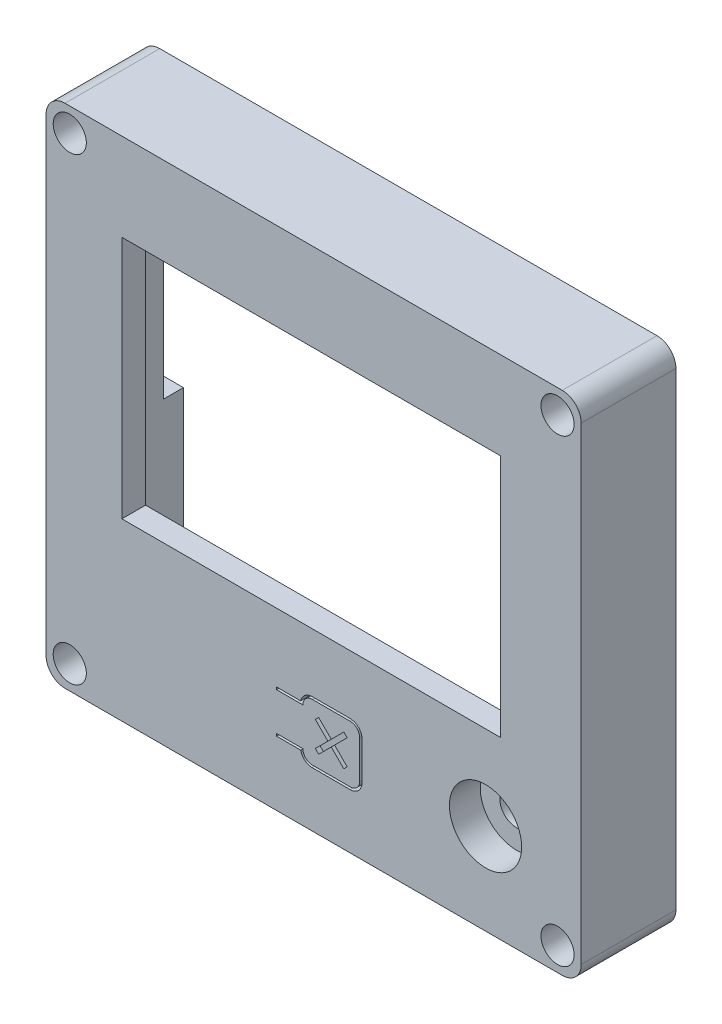
from build123d import *

# Parameters (mm, degrees)
SKETCH1_W                        = 113
SKETCH1_H                        = 107
MAIN_BODY_DEPTH                  = 5
SKETCH19_W                       = 18.5
SKETCH19_H                       = 18.5
BOSS_EXTRUDE1_DEPTH              = 3
SKETCH7_R                        = 3.5
SKETCH7_W                        = 80
SKETCH7_H                        = 51.5
SCREEN_AND_KNOB_LOCATATION_DEPTH = 79.220841213
SKETCH11_W                       = 67.654258951
SKETCH11_H                       = 30.527744354
INTERNAL_CAVITY_DEPTH            = 3
BOARDERS_DEPTH                   = 15
SKETCH6_R                        = 3.5
SCREW_HEAD_PLACEMENT_DEPTH       = 15
SKETCH10_R                       = 1.68009103
SKETCH10_R_2                     = 2
SCREW_HOLE_THROUGH_DEPTH         = 80.243296246
SKETCH14_W                       = 4.25
SKETCH14_H                       = 28
SD_CARD_SLOT_DEPTH               = 10
SKETCH15_R                       = 3
BUTTON_PRESS_DEPTH               = 8.25
GROOVE_CUT_DEPTH                 = 80.865511956
CANCEL_DECAL_DEPTH               = 1
MAIN_BODY_FILLET_R               = 4
SKETCH18_R                       = 7.625
CUT_EXTRUDE1_DEPTH               = 6.5


with BuildPart() as part:
    # Sketch1 → Main Body (new body)
    with BuildSketch(Plane.XY):
        Rectangle(SKETCH1_W, SKETCH1_H)
    extrude(amount=MAIN_BODY_DEPTH)

    # Sketch19 → Boss-Extrude1 (add)
    with BuildSketch(Plane(origin=(0, 0, 0), x_dir=(-1, 0, 0), z_dir=(0, 0, -1))):
        with Locations((-36.5, -34.5)):
            Rectangle(SKETCH19_W, SKETCH19_H)
    extrude(amount=BOSS_EXTRUDE1_DEPTH)

    # Sketch7 → Screen and knob locatation (cut, through all)
    with BuildSketch(Plane.XY.offset(5)):
        with Locations((36.3, -34.31)):
            Circle(SKETCH7_R)
        with Locations((-0.5, 9.25)):
            Rectangle(SKETCH7_W, SKETCH7_H)
    extrude(amount=-SCREEN_AND_KNOB_LOCATATION_DEPTH, mode=Mode.SUBTRACT)

    # Sketch11 → Internal cavity (cut)
    with BuildSketch(Plane(origin=(0, 0, 0), x_dir=(-1, 0, 0), z_dir=(0, 0, -1))):
        with Locations((6.575112586, -34.017474747)):
            Rectangle(SKETCH11_W, SKETCH11_H)
    extrude(amount=-INTERNAL_CAVITY_DEPTH, mode=Mode.SUBTRACT)

    # Sketch12 → Boarders (add)
    with BuildSketch(Plane(origin=(0, 0, 0), x_dir=(-1, 0, 0), z_dir=(0, 0, -1))):
        Polygon((56.5, 43.5), (56.5, 53.5), (46.5, 53.5), (-46.5, 53.5), (-56.5, 53.5), (-56.5, 43.5), (-56.5, -43.5), (-56.5, -53.5), (-46.5, -53.5), (46.5, -53.5), (56.5, -53.5), (56.5, -43.5), align=None)
        Polygon((-47.5, 44.5), (47.5, 44.5), (47.5, -44.5), (40.402242061, -44.5), (40.402242061, -49.281346924), (-27.25201689, -49.281346924), (-27.25201689, -44.5), (-47.5, -44.5), align=None, mode=Mode.SUBTRACT)
    extrude(amount=BOARDERS_DEPTH)

    # Sketch6 → Screw Head Placement (cut)
    with BuildSketch(Plane.XY.offset(5)):
        with Locations((-51.5, 48.5)):
            Circle(SKETCH6_R)
        with Locations((-51.5, -48.5)):
            Circle(SKETCH6_R)
        with Locations((51.5, -48.5)):
            Circle(SKETCH6_R)
        with Locations((51.5, 48.5)):
            Circle(SKETCH6_R)
    extrude(amount=-SCREW_HEAD_PLACEMENT_DEPTH, mode=Mode.SUBTRACT)

    # Sketch10 → Screw hole through (cut, through all)
    with BuildSketch(Plane.XY.offset(-10)):
        with Locations((-51.5, 48.5)):
            Circle(SKETCH10_R)
        with Locations((51.5, 48.5)):
            Circle(SKETCH10_R)
        with Locations((51.5, -48.5)):
            Circle(SKETCH10_R)
        with Locations((-51.5, -48.5)):
            Circle(SKETCH10_R_2)
    extrude(amount=-SCREW_HOLE_THROUGH_DEPTH, mode=Mode.SUBTRACT)

    # Sketch14 → SD Card Slot (cut)
    with BuildSketch(Plane.ZY.offset(56.5)):
        with Locations((-12.875, 8)):
            Rectangle(SKETCH14_W, SKETCH14_H)
    extrude(amount=-SD_CARD_SLOT_DEPTH, mode=Mode.SUBTRACT)

    # Sketch15 → Button Press (add)
    with BuildSketch(Plane(origin=(0, 0, 3), x_dir=(-1, 0, 0), z_dir=(0, 0, -1))):
        with Locations((-3.7199, -35.4101)):
            Circle(SKETCH15_R)
    extrude(amount=BUTTON_PRESS_DEPTH)

    # Sketch16 → Groove Cut (cut, through all)
    with BuildSketch(Plane(origin=(0, 0, 3), x_dir=(-1, 0, 0), z_dir=(0, 0, -1))):
        with BuildLine():
            Line((2.2801, -39.4101), (7.826420717, -39.4101))
            Line((7.826420717, -39.4101), (7.826420717, -39.9101))
            Line((7.826420717, -39.9101), (2.729589743, -39.9101))
            ThreePointArc((2.729589743, -39.9101), (1.86123883, -41.346591673), (0.2801, -41.9101))
            Line((0.2801, -41.9101), (-7.7199, -41.9101))
            ThreePointArc((-7.7199, -41.9101), (-9.487666953, -41.177866953), (-10.2199, -39.4101))
            Line((-10.2199, -39.4101), (-10.2199, -31.4101))
            ThreePointArc((-10.2199, -31.4101), (-9.487666953, -29.642333047), (-7.7199, -28.9101))
            Line((-7.7199, -28.9101), (0.2801, -28.9101))
            ThreePointArc((0.2801, -28.9101), (1.86123883, -29.473608327), (2.729589743, -30.9101))
            Line((2.729589743, -30.9101), (7.826420717, -30.9101))
            Line((7.826420717, -30.9101), (7.826420717, -31.4101))
            Line((7.826420717, -31.4101), (2.2801, -31.4101))
            ThreePointArc((2.2801, -31.4101), (1.694313562, -29.995886438), (0.2801, -29.4101))
            Line((0.2801, -29.4101), (-7.7199, -29.4101))
            ThreePointArc((-7.7199, -29.4101), (-9.134113562, -29.995886438), (-9.7199, -31.4101))
            Line((-9.7199, -31.4101), (-9.7199, -39.4101))
            ThreePointArc((-9.7199, -39.4101), (-9.134113562, -40.824313562), (-7.7199, -41.4101))
            Line((-7.7199, -41.4101), (0.2801, -41.4101))
            ThreePointArc((0.2801, -41.4101), (1.694313562, -40.824313562), (2.2801, -39.4101))
        make_face()
    extrude(amount=-GROOVE_CUT_DEPTH, mode=Mode.SUBTRACT)

    # Sketch17 → CAncel Decal (cut)
    with BuildSketch(Plane.XY.offset(5)):
        Polygon((0.356446609, -32.753753391), (3.012793219, -35.4101), (0.356446609, -38.066446609), (1.063553391, -38.773553391), (3.7199, -36.117206781), (6.376246609, -38.773553391), (7.083353391, -38.066446609), (4.427006781, -35.4101), (7.083353391, -32.753753391), (6.376246609, -32.046646609), (3.7199, -34.702993219), (1.063553391, -32.046646609), align=None)
    extrude(amount=-CANCEL_DECAL_DEPTH, mode=Mode.SUBTRACT)

    # Main Body Fillet
    main_body_fillet_edges = [part.edges().sort_by_distance(p)[0] for p in [
        (-56.5, -53.5, -5),
        (56.5, -53.5, -5),
        (56.5, 53.5, -5),
        (-56.5, 53.5, -5),
    ]]
    fillet(main_body_fillet_edges, radius=MAIN_BODY_FILLET_R)

    # Sketch18 → Cut-Extrude1 (cut)
    with BuildSketch(Plane.XY.offset(5)):
        with Locations((36.3, -34.31)):
            Circle(SKETCH18_R)
    extrude(amount=-CUT_EXTRUDE1_DEPTH, mode=Mode.SUBTRACT)


solid = part.part
